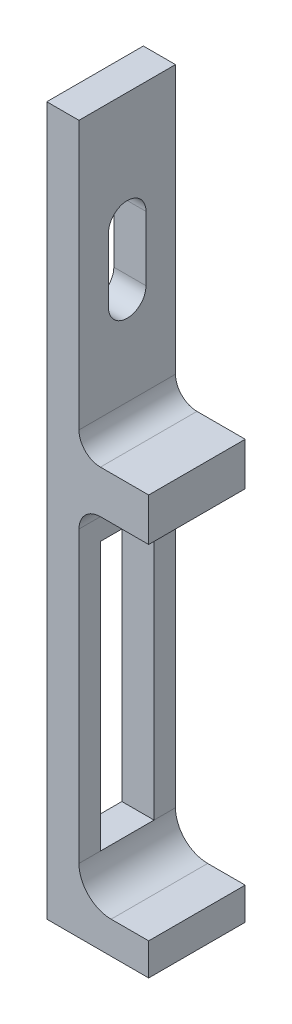
from build123d import *

# Parameters (mm, degrees)
EXTRUDE_1_DEPTH     = 9
CUT_EXTRUDE_2_DEPTH = 68.284842275
SKETCH_6_W          = 5
SKETCH_6_H          = 25
CUT_EXTRUDE_3_DEPTH = 67.927199254
FILLET_1_R          = 3
SKETCH_7_W          = 6.5
SKETCH_7_H          = 4
EXTRUDE_2_DEPTH     = 9
FILLET_2_R          = 2


with BuildPart() as part:
    # Эскиз1 → Бобышка-Вытянуть1 (new body)
    with BuildSketch(Plane.XY):
        Polygon((0, 0), (9.5, 0), (9.5, 3), (3, 3), (3, 66), (0, 66), align=None)
    extrude(amount=EXTRUDE_1_DEPTH)

    # Эскиз4 → Вырез-Вытянуть2 (cut, through all)
    with BuildSketch(Plane.ZY):
        with BuildLine():
            Line((6.25, 55.52), (6.25, 49.52))
            ThreePointArc((6.25, 49.52), (4.5, 47.77), (2.75, 49.52))
            Line((2.75, 49.52), (2.75, 55.52))
            ThreePointArc((2.75, 55.52), (4.5, 57.27), (6.25, 55.52))
        make_face()
    extrude(amount=-CUT_EXTRUDE_2_DEPTH, mode=Mode.SUBTRACT)

    # Эскиз6 → Вырез-Вытянуть3 (cut, through all)
    with BuildSketch(Plane(origin=(3, 0, 0), x_dir=(0, 0, -1), z_dir=(1, 0, 0))):
        with Locations((-4.5, 18.5)):
            Rectangle(SKETCH_6_W, SKETCH_6_H)
    extrude(amount=-CUT_EXTRUDE_3_DEPTH, mode=Mode.SUBTRACT)

    # Скругление1
    fillet_1_edges = [part.edges().sort_by_distance(p)[0] for p in [
        (3, 3, 4.5),
    ]]
    fillet(fillet_1_edges, radius=FILLET_1_R - 0.0001)  # a hair under: the kernel refuses the full size

    # Эскиз7 → Бобышка-Вытянуть2 (add)
    with BuildSketch(Plane.XY.offset(9)):
        with Locations((6.25, 37)):
            Rectangle(SKETCH_7_W, SKETCH_7_H)
    extrude(amount=-EXTRUDE_2_DEPTH)

    # Скругление2
    fillet_2_edges = [part.edges().sort_by_distance(p)[0] for p in [
        (3, 39, 4.5),
        (3, 35, 4.5),
    ]]
    fillet(fillet_2_edges, radius=FILLET_2_R)


solid = part.part
